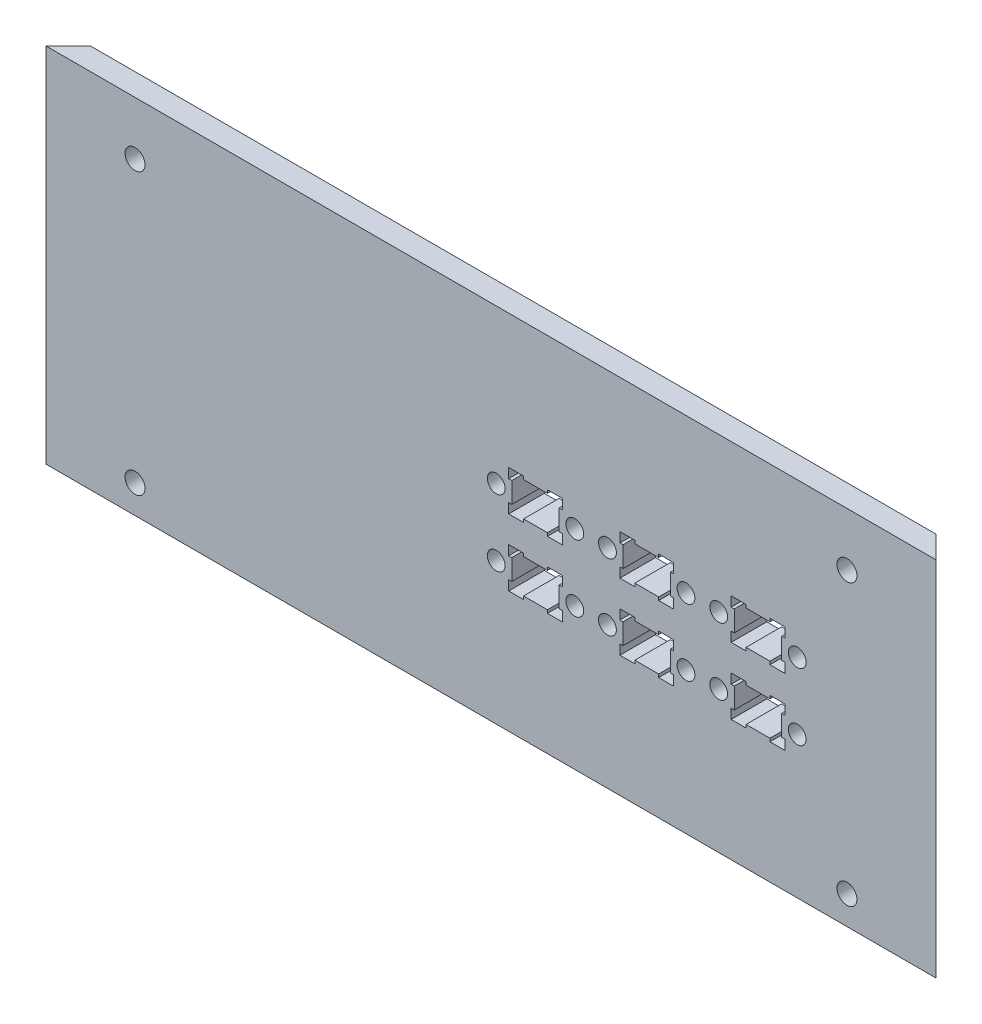
from build123d import *

# Parameters (mm, degrees)
SKETCH1_W           = 200
SKETCH1_H           = 84
SKETCH1_R           = 2.25
BOSS_EXTRUDE1_DEPTH = 5
SKETCH2_W           = 200
SKETCH2_H           = 79
SKETCH2_R           = 2.25
BOSS_EXTRUDE2_DEPTH = 3
CHAMFER1_SIZE       = 8
CHAMFER3_SIZE       = 3
SKETCH3_W           = 7.071067812
SKETCH3_H           = 2.6
CUT_EXTRUDE1_DEPTH  = 234.034075139
SKETCH4_R           = 2
CUT_EXTRUDE3_DEPTH  = 218.071416819


with BuildPart() as part:
    # Sketch1 → Boss-Extrude1 (new body)
    with BuildSketch(Plane.XY):
        with Locations((100, 42)):
            Rectangle(SKETCH1_W, SKETCH1_H)
        with Locations((20, 9)):
            Circle(SKETCH1_R, mode=Mode.SUBTRACT)
        with Locations(Location((180, 9, 0), (0, 0, 180))):
            Circle(SKETCH1_R, mode=Mode.SUBTRACT)
        with Locations((20, 72)):
            Circle(SKETCH1_R, mode=Mode.SUBTRACT)
        with Locations(Location((180, 72, 0), (0, 0, 180))):
            Circle(SKETCH1_R, mode=Mode.SUBTRACT)
    extrude(amount=-BOSS_EXTRUDE1_DEPTH)

    # Sketch2 → Boss-Extrude2 (add)
    with BuildSketch(Plane(origin=(0, 0, -5), x_dir=(-1, 0, 0), z_dir=(0, 0, -1))):
        with Locations((-100, 44.5)):
            Rectangle(SKETCH2_W, SKETCH2_H)
        with Locations(Location((-20, 9, 0), (0, 0, 180))):
            Circle(SKETCH2_R, mode=Mode.SUBTRACT)
        with Locations((-180, 9)):
            Circle(SKETCH2_R, mode=Mode.SUBTRACT)
        with Locations(Location((-20, 72, 0), (0, 0, 180))):
            Circle(SKETCH2_R, mode=Mode.SUBTRACT)
        with Locations((-180, 72)):
            Circle(SKETCH2_R, mode=Mode.SUBTRACT)
    extrude(amount=BOSS_EXTRUDE2_DEPTH)

    # Chamfer1
    # the kernel refuses this chamfer: 8 mm, written as the material it takes off along each edge
    with BuildSketch(Plane(origin=(200, -15.573463904, -8), x_dir=(-0.9996219169112968, 0, -0.027495876610586296), z_dir=(0, 1, 0)), Plane(origin=(0, 104.573463904, -8), x_dir=(0.9996219169112968, 0, -0.027495876610586275), z_dir=(0, -1, 0))) as chamfer1_piece_1:
        Polygon((CHAMFER1_SIZE * 0.999621916911, CHAMFER1_SIZE * 0.0274958766106), (-CHAMFER1_SIZE * 0.0274958766106, CHAMFER1_SIZE * 0.999621916911), (0, 0), align=None)
    extrude(amount=120.146927807, mode=Mode.SUBTRACT)

    # Chamfer3
    chamfer3_edges = [part.edges().sort_by_distance(p)[0] for p in [
        (100, 84, -8),
    ]]
    chamfer(chamfer3_edges, length=CHAMFER3_SIZE)

    # Sketch3 → Cut-Extrude1 (cut, through all, along a direction that is not the sketch's normal)
    with BuildSketch(Plane(origin=(100, 0, -100), x_dir=(-0.7071067811865452, 0, -0.7071067811865498), z_dir=(0.7071067811865498, 0, -0.7071067811865452))):
        with Locations((-137.885822331, 1.3)):
            Rectangle(SKETCH3_W, SKETCH3_H)
    extrude(amount=-CUT_EXTRUDE1_DEPTH, dir=(1, 0, 0), mode=Mode.SUBTRACT)

    # Sketch4 → Cut-Extrude3 (cut, through all)
    with BuildSketch(Plane.XY):
        Polygon((165.325, 32.115271452), (165.325, 36.765271452), (166.025, 36.765271452), (166.025, 38.965271452), (162.685, 38.965271452), (162.685, 38.265271452), (157.315, 38.265271452), (157.315, 38.965271452), (153.975, 38.965271452), (153.975, 36.765271452), (154.675, 36.765271452), (154.675, 32.115271452), (153.975, 32.115271452), (153.975, 29.915271452), (157.315, 29.915271452), (157.315, 30.615271452), (162.685, 30.615271452), (162.685, 29.915271452), (166.025, 29.915271452), (166.025, 32.115271452), align=None)
        Polygon((140.325, 32.115271452), (140.325, 36.765271452), (141.025, 36.765271452), (141.025, 38.965271452), (137.685, 38.965271452), (137.685, 38.265271452), (132.315, 38.265271452), (132.315, 38.965271452), (128.975, 38.965271452), (128.975, 36.765271452), (129.675, 36.765271452), (129.675, 32.115271452), (128.975, 32.115271452), (128.975, 29.915271452), (132.315, 29.915271452), (132.315, 30.615271452), (137.685, 30.615271452), (137.685, 29.915271452), (141.025, 29.915271452), (141.025, 32.115271452), align=None)
        Polygon((115.325, 32.115271452), (115.325, 36.765271452), (116.025, 36.765271452), (116.025, 38.965271452), (112.685, 38.965271452), (112.685, 38.265271452), (107.315, 38.265271452), (107.315, 38.965271452), (103.975, 38.965271452), (103.975, 36.765271452), (104.675, 36.765271452), (104.675, 32.115271452), (103.975, 32.115271452), (103.975, 29.915271452), (107.315, 29.915271452), (107.315, 30.615271452), (112.685, 30.615271452), (112.685, 29.915271452), (116.025, 29.915271452), (116.025, 32.115271452), align=None)
        Polygon((140.325, 47.115271452), (140.325, 51.765271452), (141.025, 51.765271452), (141.025, 53.965271452), (137.685, 53.965271452), (137.685, 53.265271452), (132.315, 53.265271452), (132.315, 53.965271452), (128.975, 53.965271452), (128.975, 51.765271452), (129.675, 51.765271452), (129.675, 47.115271452), (128.975, 47.115271452), (128.975, 44.915271452), (132.315, 44.915271452), (132.315, 45.615271452), (137.685, 45.615271452), (137.685, 44.915271452), (141.025, 44.915271452), (141.025, 47.115271452), align=None)
        Polygon((115.325, 47.115271452), (115.325, 51.765271452), (116.025, 51.765271452), (116.025, 53.965271452), (112.685, 53.965271452), (112.685, 53.265271452), (107.315, 53.265271452), (107.315, 53.965271452), (103.975, 53.965271452), (103.975, 51.765271452), (104.675, 51.765271452), (104.675, 47.115271452), (103.975, 47.115271452), (103.975, 44.915271452), (107.315, 44.915271452), (107.315, 45.615271452), (112.685, 45.615271452), (112.685, 44.915271452), (116.025, 44.915271452), (116.025, 47.115271452), align=None)
        Polygon((165.325, 47.115271452), (165.325, 51.765271452), (166.025, 51.765271452), (166.025, 53.965271452), (162.685, 53.965271452), (162.685, 53.265271452), (157.315, 53.265271452), (157.315, 53.965271452), (153.975, 53.965271452), (153.975, 51.765271452), (154.675, 51.765271452), (154.675, 47.115271452), (153.975, 47.115271452), (153.975, 44.915271452), (157.315, 44.915271452), (157.315, 45.615271452), (162.685, 45.615271452), (162.685, 44.915271452), (166.025, 44.915271452), (166.025, 47.115271452), align=None)
        with Locations((151.175, 34.440271452)):
            Circle(SKETCH4_R)
        with Locations(Location((168.825, 34.440271452, 0), (0, 0, 180))):
            Circle(SKETCH4_R)
        with Locations((126.175, 34.440271452)):
            Circle(SKETCH4_R)
        with Locations(Location((143.825, 34.440271452, 0), (0, 0, 180))):
            Circle(SKETCH4_R)
        with Locations((101.175, 34.440271452)):
            Circle(SKETCH4_R)
        with Locations(Location((118.825, 34.440271452, 0), (0, 0, 180))):
            Circle(SKETCH4_R)
        with Locations((126.175, 49.440271452)):
            Circle(SKETCH4_R)
        with Locations((143.825, 49.440271452)):
            Circle(SKETCH4_R)
        with Locations((101.175, 49.440271452)):
            Circle(SKETCH4_R)
        with Locations(Location((118.825, 49.440271452, 0), (0, 0, 180))):
            Circle(SKETCH4_R)
        with Locations((151.175, 49.440271452)):
            Circle(SKETCH4_R)
        with Locations(Location((168.825, 49.440271452, 0), (0, 0, 180))):
            Circle(SKETCH4_R)
    extrude(amount=-CUT_EXTRUDE3_DEPTH, mode=Mode.SUBTRACT)


solid = part.part
